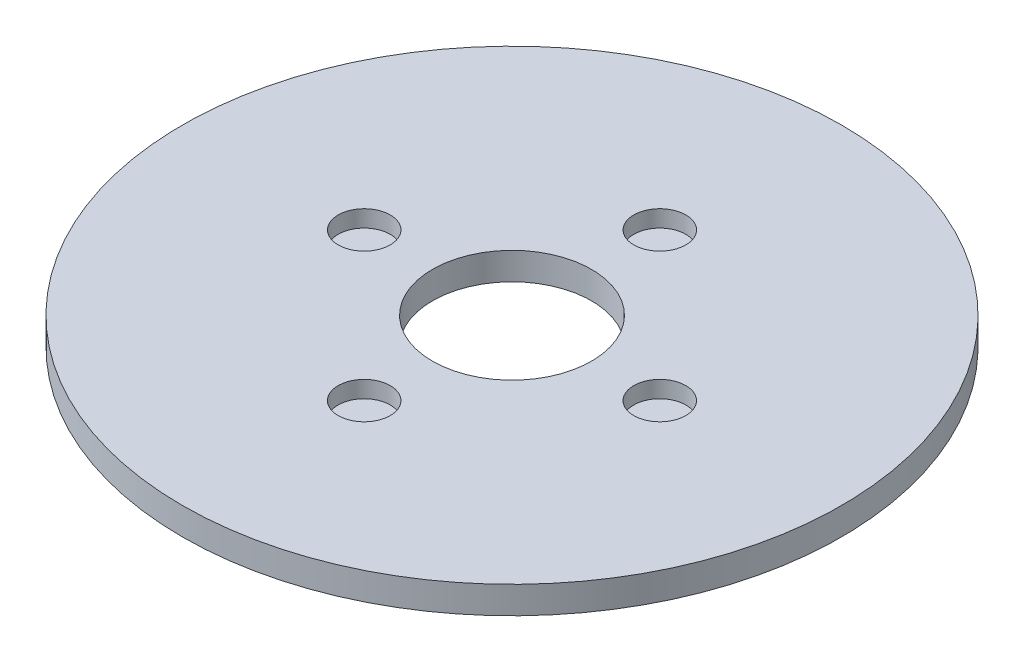
from build123d import *

# Parameters (mm, degrees)
SKETCH1_R           = 72.5
BOSS_EXTRUDE1_DEPTH = 6
SKETCH2_R           = 17.5
CUT_EXTRUDE1_DEPTH  = 103.705890776
SKETCH3_R           = 5.721006682
CUT_EXTRUDE2_DEPTH  = 3.694640352
CIRPATTERN1_COUNT   = 4


with BuildPart() as part:
    # Sketch1 → Boss-Extrude1 (new body)
    with BuildSketch(Plane(origin=(0, 0, 0), x_dir=(1, 0, 0), z_dir=(0, 1, 0))):
        Circle(SKETCH1_R)
    extrude(amount=BOSS_EXTRUDE1_DEPTH)

    # Sketch2 → Cut-Extrude1 (cut, through all)
    with BuildSketch(Plane(origin=(0, 0, 0), x_dir=(1, 0, 0), z_dir=(0, 1, 0))):
        Circle(SKETCH2_R)
    extrude(amount=CUT_EXTRUDE1_DEPTH, mode=Mode.SUBTRACT)

    # Sketch3 → Cut-Extrude2 (cut)
    with BuildSketch(Plane(origin=(0, 6, 0), x_dir=(1, 0, 0), z_dir=(0, 1, 0))):
        with Locations((-32.5149274, 0)):
            Circle(SKETCH3_R)
    cut_extrude2 = extrude(amount=-CUT_EXTRUDE2_DEPTH, mode=Mode.SUBTRACT)

    # CirPattern1: Cut-Extrude2 ×4 about axis
    cirpattern1_axis = Axis((0, 0, 0), (0, 1, 0))
    for i in range(1, CIRPATTERN1_COUNT):
        add(cut_extrude2.rotate(cirpattern1_axis, i * 360 / CIRPATTERN1_COUNT), mode=Mode.SUBTRACT)


solid = part.part
